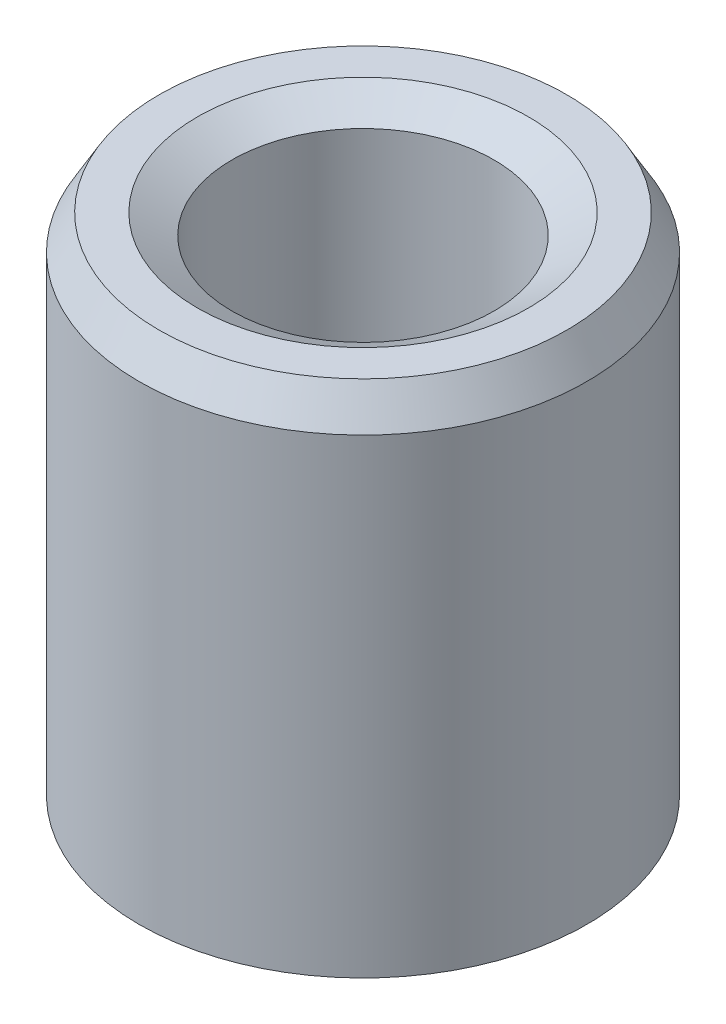
from build123d import *
from OCP.BRepFilletAPI import BRepFilletAPI_MakeChamfer

# Parameters (mm, degrees)
SKETCH1_R           = 15
BOSS_EXTRUDE1_DEPTH = 35.158970597
SKETCH2_R           = 8.779174703
CUT_EXTRUDE1_DEPTH  = 42.062795977
CHAMFER1_SIZE       = 2.316696615
CHAMFER1_SIZE2      = 1.337545414


with BuildPart() as part:
    # Sketch1 → Boss-Extrude1 (new body)
    with BuildSketch(Plane(origin=(0, 0, 0), x_dir=(1, 0, 0), z_dir=(0, 1, 0))):
        Circle(SKETCH1_R)
    extrude(amount=BOSS_EXTRUDE1_DEPTH)

    # Sketch2 → Cut-Extrude1 (cut, through all)
    with BuildSketch(Plane(origin=(0, 0, 0), x_dir=(1, 0, 0), z_dir=(0, 1, 0))):
        Circle(SKETCH2_R)
    extrude(amount=CUT_EXTRUDE1_DEPTH, mode=Mode.SUBTRACT)

    # Chamfer1: one chamfer whose edges measure the first distance from different faces: ONE call of the kernel's chamfer builder (chamfer() names one face for all edges)
    chamfer1_edges_1 = [part.edges().sort_by_distance(p)[0] for p in [
        (-8.779174703, 35.158970597, 0),
    ]]
    chamfer1_side_1 = [part.faces().sort_by_distance(p)[0] for p in [
        (-14.575735931, 35.158970597, 0),
    ]]
    chamfer1_edges_2 = [part.edges().sort_by_distance(p)[0] for p in [
        (-8.779174703, 0, 0),
    ]]
    chamfer1_side_2 = [part.faces().sort_by_distance(p)[0] for p in [
        (-8.779174703, 17.579485299, 0),
    ]]
    chamfer1_edges_3 = [part.edges().sort_by_distance(p)[0] for p in [
        (-15, 0, 0),
    ]]
    chamfer1_side_3 = [part.faces().sort_by_distance(p)[0] for p in [
        (-14.575735931, 0, 0),
    ]]
    chamfer1_edges_4 = [part.edges().sort_by_distance(p)[0] for p in [
        (-15, 35.158970597, 0),
    ]]
    chamfer1_side_4 = [part.faces().sort_by_distance(p)[0] for p in [
        (-15, 17.579485299, 0),
    ]]
    chamfer1 = BRepFilletAPI_MakeChamfer(part.part.solid().wrapped)
    for e in chamfer1_edges_1:
        chamfer1.Add(CHAMFER1_SIZE, CHAMFER1_SIZE2, e.wrapped, chamfer1_side_1[0].wrapped)  # the first distance lies on this face
    for e in chamfer1_edges_2:
        chamfer1.Add(CHAMFER1_SIZE, CHAMFER1_SIZE2, e.wrapped, chamfer1_side_2[0].wrapped)  # the first distance lies on this face
    for e in chamfer1_edges_3:
        chamfer1.Add(CHAMFER1_SIZE, CHAMFER1_SIZE2, e.wrapped, chamfer1_side_3[0].wrapped)  # the first distance lies on this face
    for e in chamfer1_edges_4:
        chamfer1.Add(CHAMFER1_SIZE, CHAMFER1_SIZE2, e.wrapped, chamfer1_side_4[0].wrapped)  # the first distance lies on this face
    add(Compound.cast(chamfer1.Shape()), mode=Mode.REPLACE)


solid = part.part
